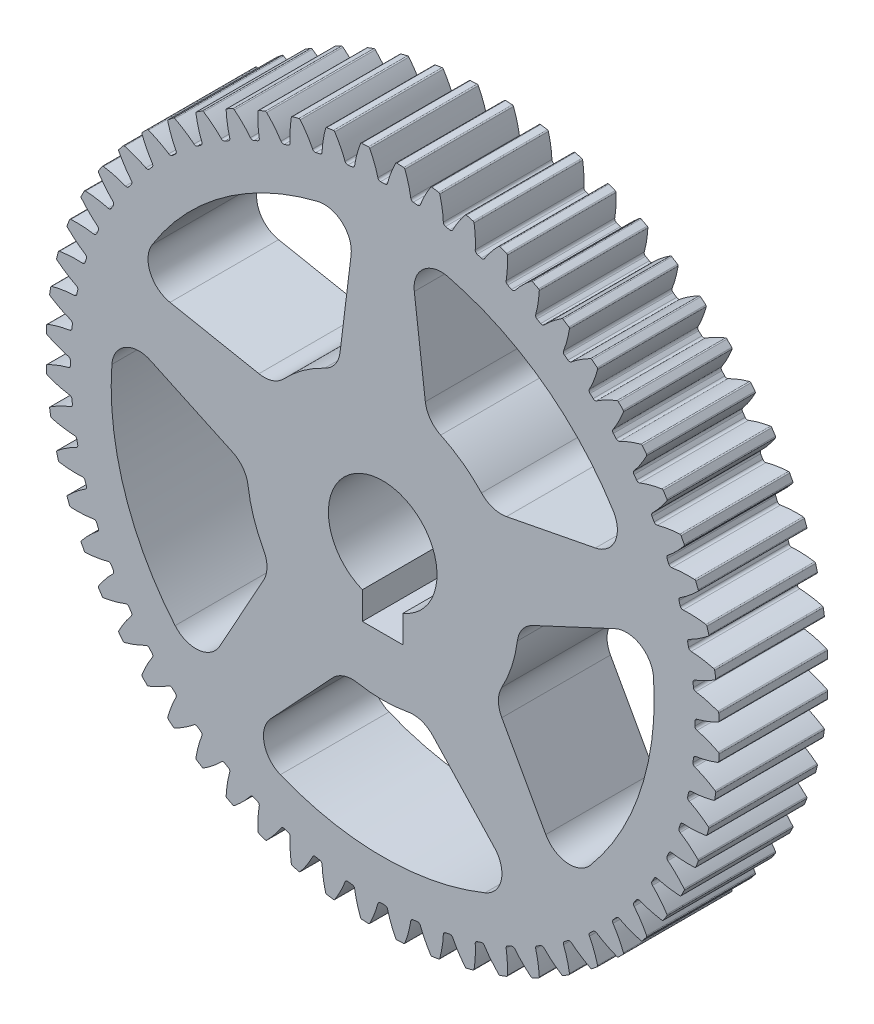
from build123d import *

# Parameters (mm, degrees)
SKETCH1_R                            = 39.37
BOSS_EXTRUDE1_DEPTH                  = 12.7
CUT_EXTRUDE_DCGTBC_DEPTH             = 58.107650976
FILLET_DCGTBC_R                      = 0.16191473
CIRPATTERN_DCGTBC_COUNT              = 60
FILLET_DCGTBC_OF_CIRPATTERN_DCGTBC_R = 0.16191473
SKETCH4_R                            = 4.7625
CUT_EXTRUDE2_DEPTH                   = 58.059181876
SKETCH5_R                            = 6.35
CUT_EXTRUDE3_DEPTH                   = 58.059181876
SKETCH6_W                            = 4.7625
SKETCH6_H                            = 5.49148
CUT_EXTRUDE4_DEPTH                   = 58.059181876
CUT_EXTRUDE5_DEPTH                   = 58.059181876
FILLET1_R                            = 3.175


with BuildPart() as part:
    # Sketch1 → Boss-Extrude1 (new body)
    with BuildSketch(Plane.XY):
        Circle(SKETCH1_R)
    extrude(amount=BOSS_EXTRUDE1_DEPTH)

    # DCGTBC → Cut-Extrude-DCGTBC (cut, through all)
    with BuildSketch(Plane.XY):
        with BuildLine():
            add(Edge.make_bspline(
                [(0.564673794, 36.757139), (0.569752824, 36.77751056), (0.587706523, 36.848517624), (0.620851797, 36.973683165), (0.672070042, 37.152885261), (0.737239862, 37.363834604), (0.808836317, 37.578651296), (0.883543476, 37.789880551), (0.963928396, 38.003116718), (1.045179017, 38.209304019), (1.134608426, 38.423274879), (1.21971488, 38.620680309), (1.320648819, 38.841622259), (1.403731936, 39.019858567), (1.494221571, 39.203784748), (1.538952316, 39.293274658), (1.562102909, 39.33899763)],
                knots=[0.235927291, 0.235927291, 0.235927291, 0.235927291, 0.235927291, 0.256307345, 0.307035032, 0.361767352, 0.416499661, 0.471231937, 0.525964282, 0.580696616, 0.635428982, 0.690161387, 0.744893688, 0.799626082, 0.854358407, 0.909090914, 0.909090914, 0.909090914, 0.909090914, 0.909090914], degree=4))
            ThreePointArc((1.562102909, 39.33899763), (0, 39.37), (-1.562102909, 39.33899763))
            add(Edge.make_bspline(
                [(-0.564673794, 36.757139), (-0.569752824, 36.77751056), (-0.587706523, 36.848517624), (-0.620851797, 36.973683165), (-0.672070042, 37.152885261), (-0.737239862, 37.363834604), (-0.808836317, 37.578651296), (-0.883543476, 37.789880551), (-0.963928396, 38.003116718), (-1.045179017, 38.209304019), (-1.134608426, 38.423274879), (-1.21971488, 38.620680309), (-1.320648819, 38.841622259), (-1.403731936, 39.019858567), (-1.494221571, 39.203784748), (-1.538952316, 39.293274658), (-1.562102909, 39.33899763)],
                knots=[0.235927291, 0.235927291, 0.235927291, 0.235927291, 0.235927291, 0.256307345, 0.307035032, 0.361767352, 0.416499661, 0.471231937, 0.525964282, 0.580696616, 0.635428982, 0.690161387, 0.744893688, 0.799626082, 0.854358407, 0.909090914, 0.909090914, 0.909090914, 0.909090914, 0.909090914], degree=4))
            ThreePointArc((-0.564673794, 36.757139), (-0.448964478, 36.579621325), (-0.248261007, 36.511655984))
            ThreePointArc((-0.248261007, 36.511655984), (0, 36.5125), (0.248261007, 36.511655984))
            ThreePointArc((0.248261007, 36.511655984), (0.448964478, 36.579621325), (0.564673794, 36.757139))
        make_face()
    cut_extrude_dcgtbc = extrude(amount=CUT_EXTRUDE_DCGTBC_DEPTH, mode=Mode.SUBTRACT)

    # Fillet-DCGTBC
    fillet_dcgtbc_edges = [part.edges().sort_by_distance(p)[0] for p in [
        (1.562102909, 39.33899763, 6.35),
        (-1.562102909, 39.33899763, 6.35),
    ]]
    fillet(fillet_dcgtbc_edges, radius=FILLET_DCGTBC_R)

    # CirPattern-DCGTBC: Cut-Extrude-DCGTBC ×60 about axis
    cirpattern_dcgtbc_axis = Axis((0, 0, 12.7), (0, 0, 1))
    for i in range(1, CIRPATTERN_DCGTBC_COUNT):
        add(cut_extrude_dcgtbc.rotate(cirpattern_dcgtbc_axis, i * 360 / CIRPATTERN_DCGTBC_COUNT), mode=Mode.SUBTRACT)

    # Fillet-DCGTBC of CirPattern-DCGTBC
    fillet_dcgtbc_of_cirpattern_dcgtbc_edges = [part.edges().sort_by_distance(p)[0] for p in [
        (-2.558499423, 39.286778701, 6.35),
        (-5.665590515, 38.960210268, 6.35),
        (-6.6510703, 38.804125604, 6.35),
        (-9.707004725, 38.15456669, 6.35),
        (-10.670770658, 37.896326386, 6.35),
        (-13.64206696, 36.930893694, 6.35),
        (-14.573559821, 36.573327086, 6.35),
        (-17.427663855, 35.302598099, 6.35),
        (-18.316678012, 34.849622761, 6.35),
        (-21.022319617, 33.287519852, 6.35),
        (-21.859114846, 32.744098677, 6.35),
        (-24.386650447, 30.907736571, 6.35),
        (-25.162058644, 30.279823395, 6.35),
        (-27.483796031, 28.189321661, 6.35),
        (-28.189321661, 27.483796031, 6.35),
        (-30.279823395, 25.162058644, 6.35),
        (-30.907736571, 24.386650447, 6.35),
        (-32.744098677, 21.859114846, 6.35),
        (-33.287519852, 21.022319617, 6.35),
        (-34.849622761, 18.316678012, 6.35),
        (-35.302598099, 17.427663855, 6.35),
        (-36.573327086, 14.573559821, 6.35),
        (-36.930893694, 13.64206696, 6.35),
        (-37.896326386, 10.670770658, 6.35),
        (-38.15456669, 9.707004725, 6.35),
        (-38.804125604, 6.6510703, 6.35),
        (-38.960210268, 5.665590515, 6.35),
        (-39.286778701, 2.558499423, 6.35),
        (-39.33899763, 1.562102909, 6.35),
        (-39.33899763, -1.562102909, 6.35),
        (-39.286778701, -2.558499423, 6.35),
        (-38.960210268, -5.665590515, 6.35),
        (-38.804125604, -6.6510703, 6.35),
        (-38.15456669, -9.707004725, 6.35),
        (-37.896326386, -10.670770658, 6.35),
        (-36.930893694, -13.64206696, 6.35),
        (-36.573327086, -14.573559821, 6.35),
        (-35.302598099, -17.427663855, 6.35),
        (-34.849622761, -18.316678012, 6.35),
        (-33.287519852, -21.022319617, 6.35),
        (-32.744098677, -21.859114846, 6.35),
        (-30.907736571, -24.386650447, 6.35),
        (-30.279823395, -25.162058644, 6.35),
        (-28.189321661, -27.483796031, 6.35),
        (-27.483796031, -28.189321661, 6.35),
        (-25.162058644, -30.279823395, 6.35),
        (-24.386650447, -30.907736571, 6.35),
        (-21.859114846, -32.744098677, 6.35),
        (-21.022319617, -33.287519852, 6.35),
        (-18.316678012, -34.849622761, 6.35),
        (-17.427663855, -35.302598099, 6.35),
        (-14.573559821, -36.573327086, 6.35),
        (-13.64206696, -36.930893694, 6.35),
        (-10.670770658, -37.896326386, 6.35),
        (-9.707004725, -38.15456669, 6.35),
        (-6.6510703, -38.804125604, 6.35),
        (-5.665590515, -38.960210268, 6.35),
        (-2.558499423, -39.286778701, 6.35),
        (-1.562102909, -39.33899763, 6.35),
        (1.562102909, -39.33899763, 6.35),
        (2.558499423, -39.286778701, 6.35),
        (5.665590515, -38.960210268, 6.35),
        (6.6510703, -38.804125604, 6.35),
        (9.707004725, -38.15456669, 6.35),
        (10.670770658, -37.896326386, 6.35),
        (13.64206696, -36.930893694, 6.35),
        (14.573559821, -36.573327086, 6.35),
        (17.427663855, -35.302598099, 6.35),
        (18.316678012, -34.849622761, 6.35),
        (21.022319617, -33.287519852, 6.35),
        (21.859114846, -32.744098677, 6.35),
        (24.386650447, -30.907736571, 6.35),
        (25.162058644, -30.279823395, 6.35),
        (27.483796031, -28.189321661, 6.35),
        (28.189321661, -27.483796031, 6.35),
        (30.279823395, -25.162058644, 6.35),
        (30.907736571, -24.386650447, 6.35),
        (32.744098677, -21.859114846, 6.35),
        (33.287519852, -21.022319617, 6.35),
        (34.849622761, -18.316678012, 6.35),
        (35.302598099, -17.427663855, 6.35),
        (36.573327086, -14.573559821, 6.35),
        (36.930893694, -13.64206696, 6.35),
        (37.896326386, -10.670770658, 6.35),
        (38.15456669, -9.707004725, 6.35),
        (38.804125604, -6.6510703, 6.35),
        (38.960210268, -5.665590515, 6.35),
        (39.286778701, -2.558499423, 6.35),
        (39.33899763, -1.562102909, 6.35),
        (39.33899763, 1.562102909, 6.35),
        (39.286778701, 2.558499423, 6.35),
        (38.960210268, 5.665590515, 6.35),
        (38.804125604, 6.6510703, 6.35),
        (38.15456669, 9.707004725, 6.35),
        (37.896326386, 10.670770658, 6.35),
        (36.930893694, 13.64206696, 6.35),
        (36.573327086, 14.573559821, 6.35),
        (35.302598099, 17.427663855, 6.35),
        (34.849622761, 18.316678012, 6.35),
        (33.287519852, 21.022319617, 6.35),
        (32.744098677, 21.859114846, 6.35),
        (30.907736571, 24.386650447, 6.35),
        (30.279823395, 25.162058644, 6.35),
        (28.189321661, 27.483796031, 6.35),
        (27.483796031, 28.189321661, 6.35),
        (25.162058644, 30.279823395, 6.35),
        (24.386650447, 30.907736571, 6.35),
        (21.859114846, 32.744098677, 6.35),
        (21.022319617, 33.287519852, 6.35),
        (18.316678012, 34.849622761, 6.35),
        (17.427663855, 35.302598099, 6.35),
        (14.573559821, 36.573327086, 6.35),
        (13.64206696, 36.930893694, 6.35),
        (10.670770658, 37.896326386, 6.35),
        (9.707004725, 38.15456669, 6.35),
        (6.6510703, 38.804125604, 6.35),
        (5.665590515, 38.960210268, 6.35),
        (2.558499423, 39.286778701, 6.35),
    ]]
    fillet(fillet_dcgtbc_of_cirpattern_dcgtbc_edges, radius=FILLET_DCGTBC_OF_CIRPATTERN_DCGTBC_R)

    # Sketch4 → Cut-Extrude2 (cut, through all)
    with BuildSketch(Plane.XY.offset(12.7)):
        Circle(SKETCH4_R)
    extrude(amount=-CUT_EXTRUDE2_DEPTH, mode=Mode.SUBTRACT)

    # Sketch5 → Cut-Extrude3 (cut, through all)
    with BuildSketch(Plane.XY.offset(12.7)):
        Circle(SKETCH5_R)
    extrude(amount=-CUT_EXTRUDE3_DEPTH, mode=Mode.SUBTRACT)

    # Sketch6 → Cut-Extrude4 (cut, through all)
    with BuildSketch(Plane.XY.offset(12.7)):
        with Locations((0, -6.35)):
            Rectangle(SKETCH6_W, SKETCH6_H)
    extrude(amount=-CUT_EXTRUDE4_DEPTH, mode=Mode.SUBTRACT)

    # Sketch7 → Cut-Extrude5 (cut, through all)
    with BuildSketch(Plane.XY.offset(12.7)):
        with BuildLine():
            Line((-5.212743334, 14.994763484), (-3.175, 31.590851128))
            ThreePointArc((-3.175, 31.590851128), (-18.66218176, 25.686289571), (-29.063555864, 12.781714305))
            Line((-29.063555864, 12.781714305), (-12.650041244, 9.591250259))
            ThreePointArc((-12.650041244, 9.591250259), (-9.33109088, 12.843144786), (-5.212743334, 14.994763484))
        make_face()
        with BuildLine():
            ThreePointArc((29.063555864, 12.781714305), (18.66218176, 25.686289571), (3.175, 31.590851128))
            Line((3.175, 31.590851128), (5.212743334, 14.994763484))
            ThreePointArc((5.212743334, 14.994763484), (9.33109088, 12.843144786), (12.650041244, 9.591250259))
            Line((12.650041244, 9.591250259), (29.063555864, 12.781714305))
        make_face()
        with BuildLine():
            ThreePointArc((31.75, 0), (31.568434293, 3.390642458), (31.025813778, 6.742505426))
            Line((31.025813778, 6.742505426), (15.871693799, -0.323976773))
            ThreePointArc((15.871693799, -0.323976773), (15.098022196, -4.905644786), (13.030898782, -9.067044829))
            Line((13.030898782, -9.067044829), (21.137265358, -23.691317253))
            ThreePointArc((21.137265358, -23.691317253), (28.975599002, -12.979875286), (31.75, 0))
        make_face()
        with BuildLine():
            Line((-4.596502893, -15.194992141), (-16.000007443, -27.423753605))
            ThreePointArc((-16.000007443, -27.423753605), (0, -31.75), (16.000007443, -27.423753605))
            Line((16.000007443, -27.423753605), (4.596502893, -15.194992141))
            ThreePointArc((4.596502893, -15.194992141), (0, -15.875), (-4.596502893, -15.194992141))
        make_face()
        with BuildLine():
            Line((-15.871693799, -0.323976773), (-31.025813778, 6.742505426))
            ThreePointArc((-31.025813778, 6.742505426), (-30.196044392, -9.811289571), (-21.137265358, -23.691317253))
            Line((-21.137265358, -23.691317253), (-13.030898782, -9.067044829))
            ThreePointArc((-13.030898782, -9.067044829), (-15.098022196, -4.905644786), (-15.871693799, -0.323976773))
        make_face()
    extrude(amount=-CUT_EXTRUDE5_DEPTH, mode=Mode.SUBTRACT)

    # Fillet1
    fillet1_edges = [part.edges().sort_by_distance(p)[0] for p in [
        (29.063555864, 12.781714305, 6.35),
        (12.650041244, 9.591250259, 6.35),
        (5.212743334, 14.994763484, 6.35),
        (3.175, 31.590851128, 6.35),
        (21.137265358, -23.691317253, 6.35),
        (13.030898782, -9.067044829, 6.35),
        (15.871693799, -0.323976773, 6.35),
        (31.025813778, 6.742505426, 6.35),
        (-31.025813778, 6.742505426, 6.35),
        (-15.871693799, -0.323976773, 6.35),
        (-13.030898782, -9.067044829, 6.35),
        (-21.137265358, -23.691317253, 6.35),
        (-16.000007443, -27.423753605, 6.35),
        (-4.596502893, -15.194992141, 6.35),
        (4.596502893, -15.194992141, 6.35),
        (16.000007443, -27.423753605, 6.35),
        (-3.175, 31.590851128, 6.35),
        (-5.212743334, 14.994763484, 6.35),
        (-12.650041244, 9.591250259, 6.35),
        (-29.063555864, 12.781714305, 6.35),
    ]]
    fillet(fillet1_edges, radius=FILLET1_R)


solid = part.part
